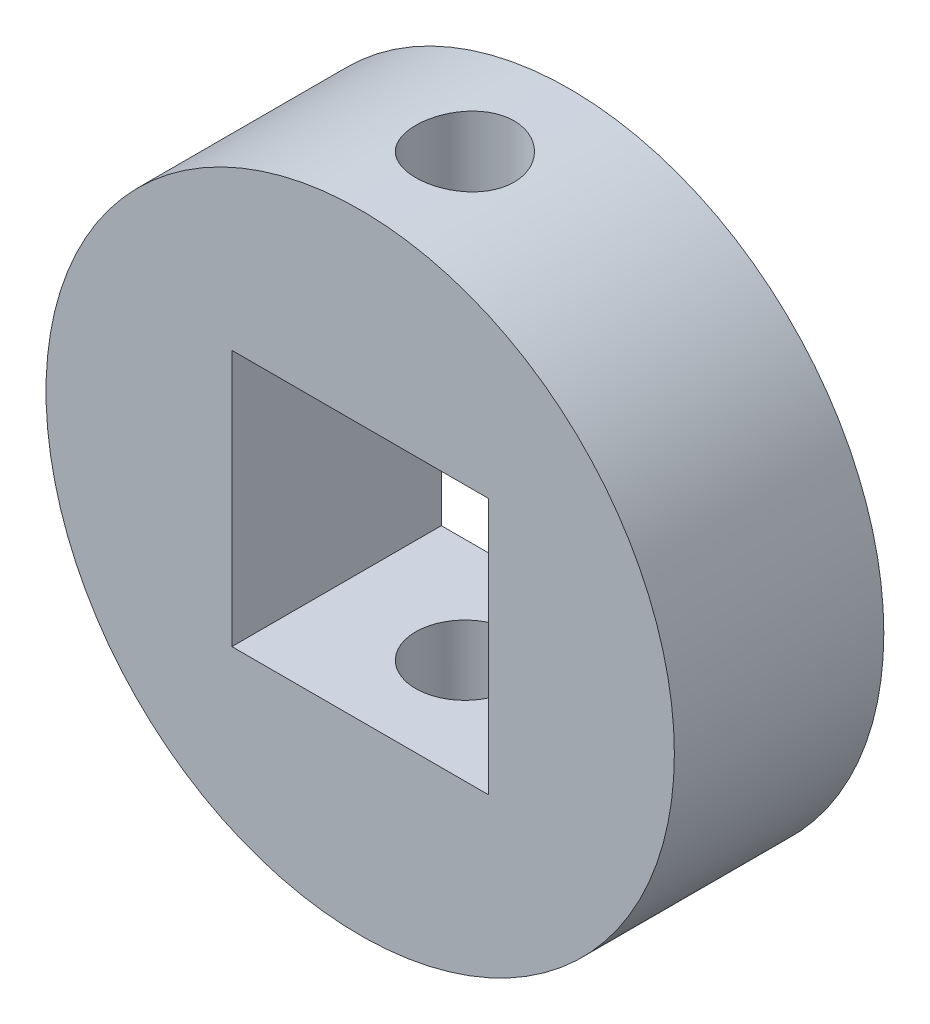
from build123d import *

# Parameters (mm, degrees)
ESBO_O1_R                  = 15
ESBO_O1_W                  = 12.25
ESBO_O1_H                  = 12.25
RESSALTO_EXTRUS_O1_DEPTH   = 10
CORTE_EXTRUS_O1_DEPTH      = 24
CORTE_EXTRUS_O1_DEPTH_BACK = 24
ESBO_O2_R                  = 2.35


with BuildPart() as part:
    # Esboço1 → Ressalto-extrusão1 (new body)
    with BuildSketch(Plane.XY):
        Circle(ESBO_O1_R)
        Rectangle(ESBO_O1_W, ESBO_O1_H, mode=Mode.SUBTRACT)
    extrude(amount=RESSALTO_EXTRUS_O1_DEPTH)

    # Esboço2 → Corte-extrusão1 (cut, two sides: drawn at the far end of the back side and taken through both)
    with BuildSketch(Plane(origin=(0, 0, 0), x_dir=(1, 0, 0), z_dir=(0, 1, 0)).offset(-CORTE_EXTRUS_O1_DEPTH_BACK)):
        with Locations((0, -5)):
            Circle(ESBO_O2_R)
    extrude(amount=CORTE_EXTRUS_O1_DEPTH + CORTE_EXTRUS_O1_DEPTH_BACK, mode=Mode.SUBTRACT)


solid = part.part
